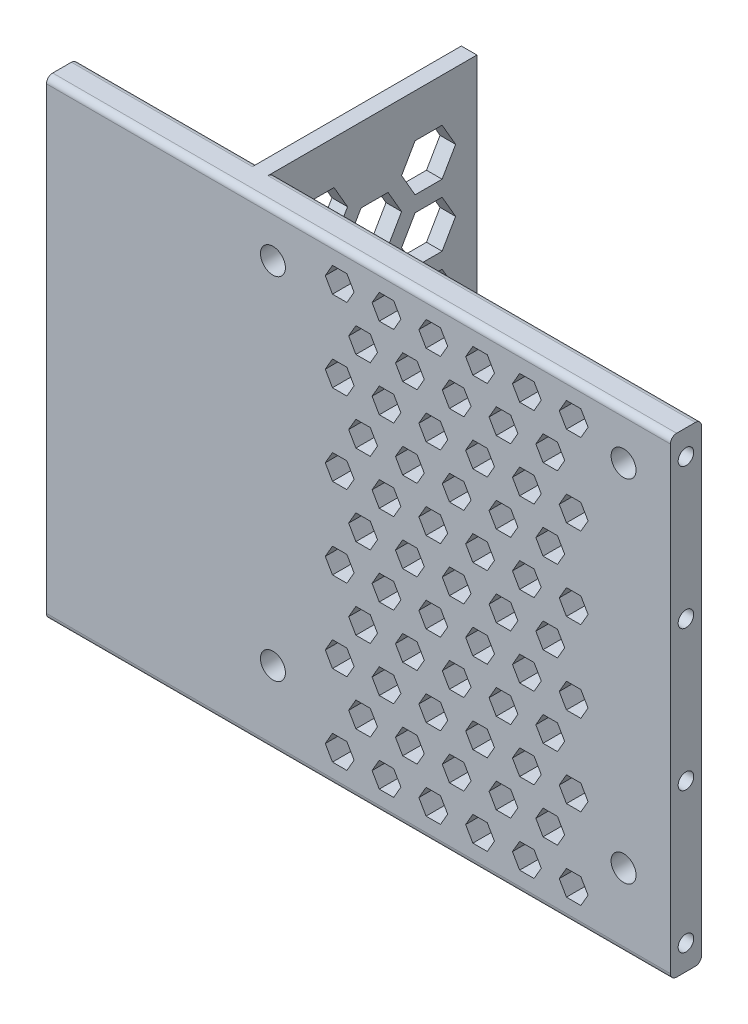
from build123d import *

# Parameters (mm, degrees)
SKETCH_1_W                   = 200
SKETCH_1_H                   = 151
SKETCH_1_R                   = 1.8
EXTRUDE_1_DEPTH              = 10
SKETCH_2_R                   = 2.5
CUT_EXTRUDE_1_DEPTH          = 15
SKETCH_3_R                   = 4
CUT_EXTRUDE_2_DEPTH          = 7
SKETCH_4_W                   = 5
SKETCH_4_H                   = 151
EXTRUDE_2_DEPTH              = 65
CUT_EXTRUDE_3_REACH          = 147.61
SPLIT_START                  = -65
SPLIT_BODIES_1_OUTLINE_W     = 5
SPLIT_BODIES_1_OUTLINE_H     = 151
SPLIT_BODIES_1_DEPTH         = 75
SPLIT_BODIES_1_2_OUTLINE_W   = 18
SPLIT_BODIES_1_2_OUTLINE_H   = 151
SPLIT_BODIES_1_2_OUTLINE_R   = 4
SPLIT_BODIES_1_2_OUTLINE_W_2 = 5
SPLIT_BODIES_1_2_DEPTH       = 10
SPLIT_BODIES_1_3_OUTLINE_R   = 4
SPLIT_BODIES_1_3_OUTLINE_R_2 = 1.8
SPLIT_BODIES_1_3_DEPTH       = 3
SPLIT_BODIES_1_4_OUTLINE_W   = 99
SPLIT_BODIES_1_4_OUTLINE_H   = 151
SPLIT_BODIES_1_4_DEPTH       = 10
SPLIT_START_2                = -102.846480906
SPLIT_BODIES_1_5_OUTLINE_W   = 151
SPLIT_BODIES_1_5_OUTLINE_H   = 10
SPLIT_BODIES_1_5_OUTLINE_R   = 2.5
SPLIT_BODIES_1_5_DEPTH       = 15
SPLIT_BODIES_1_6_OUTLINE_W   = 151
SPLIT_BODIES_1_6_OUTLINE_H   = 75
SPLIT_BODIES_1_6_DEPTH       = 180
SPLIT_START_3                = -87.846480906
SPLIT_BODIES_1_7_OUTLINE_W   = 151
SPLIT_BODIES_1_7_OUTLINE_H   = 10
SPLIT_BODIES_1_7_DEPTH       = 38
OTHER_2_DEPTH                = 10
FILLET_1_R                   = 2
CUT_EXTRUDE_4_REACH          = 177.468
OTHER_START                  = -44.846480906
OTHER_3_DEPTH                = 5


with BuildPart() as part:
    # 草图1 → 凸台-拉伸1 (new body)
    with BuildSketch(Plane.XY):
        with Locations((-2.846480906, -4.5)):
            Rectangle(SKETCH_1_W, SKETCH_1_H)
        with Locations((-30.246480906, 56.2)):
            Circle(SKETCH_1_R, mode=Mode.SUBTRACT)
        with Locations((82.153519094, 56.2)):
            Circle(SKETCH_1_R, mode=Mode.SUBTRACT)
        with Locations((82.153519094, -56.2)):
            Circle(SKETCH_1_R, mode=Mode.SUBTRACT)
        with Locations((-30.246480906, -56.2)):
            Circle(SKETCH_1_R, mode=Mode.SUBTRACT)
    extrude(amount=EXTRUDE_1_DEPTH)

    # 草图2 → 切除-拉伸1 (cut)
    with BuildSketch(Plane.ZY.offset(102.846480906)):
        with Locations((5, 63)):
            Circle(SKETCH_2_R)
        with Locations((5, 18)):
            Circle(SKETCH_2_R)
        with Locations((5, -27)):
            Circle(SKETCH_2_R)
        with Locations((5, -72)):
            Circle(SKETCH_2_R)
    cut_extrude_1 = extrude(amount=-CUT_EXTRUDE_1_DEPTH, mode=Mode.SUBTRACT)

    # 镜向1: 切除-拉伸1 across plane
    add(cut_extrude_1.mirror(Plane.ZY.offset(2.846480906)), mode=Mode.SUBTRACT)

    # 草图3 → 切除-拉伸2 (cut)
    with BuildSketch(Plane.XY.offset(10)):
        with Locations((-30.246480906, 56.2)):
            Circle(SKETCH_3_R)
        with Locations((82.153519094, 56.2)):
            Circle(SKETCH_3_R)
        with Locations((82.153519094, -56.2)):
            Circle(SKETCH_3_R)
        with Locations((-30.246480906, -56.2)):
            Circle(SKETCH_3_R)
    extrude(amount=-CUT_EXTRUDE_2_DEPTH, mode=Mode.SUBTRACT)

    # 草图4 → 凸台-拉伸2 (add)
    with BuildSketch(Plane(origin=(0, 0, 0), x_dir=(-1, 0, 0), z_dir=(0, 0, -1))):
        with Locations((42.346480906, -4.5)):
            Rectangle(SKETCH_4_W, SKETCH_4_H)
    extrude(amount=EXTRUDE_2_DEPTH)

    # 草图5 → 切除-拉伸3 (cut, up to next)
    with BuildSketch(Plane(origin=(0, 0, 0), x_dir=(-1, 0, 0), z_dir=(0, 0, -1)), mode=Mode.PRIVATE) as cut_extrude_3_sk1:
        Polygon((-24.034716941, -4.5), (-26.344118017, -0.5), (-30.962920171, -0.5), (-33.272321248, -4.5), (-30.962920171, -8.5), (-26.344118017, -8.5), align=None)
    cut_extrude_3_tool1 = extrude(cut_extrude_3_sk1.sketch, amount=-CUT_EXTRUDE_3_REACH, mode=Mode.PRIVATE) & part.part
    add(cut_extrude_3_tool1.solids().sort_by_distance((28.653519, -4.5, 0))[0], mode=Mode.SUBTRACT)

    # Split Bodies 1 6 outline → Split Bodies 1 6 (cut)
    with BuildSketch(Plane.YZ.offset(SPLIT_START_2)):
        with Locations((-4.5, -27.5)):
            Rectangle(SPLIT_BODIES_1_6_OUTLINE_W, SPLIT_BODIES_1_6_OUTLINE_H)
    extrude(amount=SPLIT_BODIES_1_6_DEPTH, mode=Mode.SUBTRACT)


with BuildPart() as body_2:
    # Split Bodies 1: read off the stored shape, not the designer's step
    # Split Bodies 1 outline → Split Bodies 1 (new body)
    with BuildSketch(Plane.XY.offset(SPLIT_START)):
        with Locations((-42.346480906, -4.5)):
            Rectangle(SPLIT_BODIES_1_OUTLINE_W, SPLIT_BODIES_1_OUTLINE_H)
    extrude(amount=SPLIT_BODIES_1_DEPTH)

    # Split Bodies 1 2 outline → Split Bodies 1 2 (add)
    # profile 1 of 2: a face of its own
    with BuildSketch(Plane.XY):
        with Locations((-30.846480906, -4.5)):
            Rectangle(SPLIT_BODIES_1_2_OUTLINE_W, SPLIT_BODIES_1_2_OUTLINE_H)
        with Locations((-30.246480906, -56.2)):
            Circle(SPLIT_BODIES_1_2_OUTLINE_R, mode=Mode.SUBTRACT)
        with Locations((-30.246480906, 56.2)):
            Circle(SPLIT_BODIES_1_2_OUTLINE_R, mode=Mode.SUBTRACT)
    # profile 2 of 2: a face of its own
    with BuildSketch(Plane.XY):
        with Locations((-47.346480906, -4.5)):
            Rectangle(SPLIT_BODIES_1_2_OUTLINE_W_2, SPLIT_BODIES_1_2_OUTLINE_H)
    extrude(amount=SPLIT_BODIES_1_2_DEPTH)

    # Split Bodies 1 3 outline → Split Bodies 1 3 (add)
    # profile 1 of 2: a face of its own
    with BuildSketch(Plane.XY):
        with Locations((-30.246480906, 56.2)):
            Circle(SPLIT_BODIES_1_3_OUTLINE_R)
        with Locations((-30.246480906, 56.2)):
            Circle(SPLIT_BODIES_1_3_OUTLINE_R_2, mode=Mode.SUBTRACT)
    # profile 2 of 2: a face of its own
    with BuildSketch(Plane.XY):
        with Locations((-30.246480906, -56.2)):
            Circle(SPLIT_BODIES_1_3_OUTLINE_R)
        with Locations((-30.246480906, -56.2)):
            Circle(SPLIT_BODIES_1_3_OUTLINE_R_2, mode=Mode.SUBTRACT)
    extrude(amount=SPLIT_BODIES_1_3_DEPTH)


with BuildPart() as body_3:
    # Split Bodies 1 4 outline → Split Bodies 1 4 (new body)
    with BuildSketch(Plane.XY):
        with Locations((27.653519094, -4.5)):
            Rectangle(SPLIT_BODIES_1_4_OUTLINE_W, SPLIT_BODIES_1_4_OUTLINE_H)
        Polygon((30.962920171, -8.5), (26.344118017, -8.5), (24.034716941, -4.5), (26.344118017, -0.5), (30.962920171, -0.5), (33.272321248, -4.5), align=None, mode=Mode.SUBTRACT)
    extrude(amount=SPLIT_BODIES_1_4_DEPTH)

    # 填充阵列2: read off the stored shape, not the designer's step
    # 填充阵列2 outline → 填充阵列2 (cut)
    with BuildSketch(Plane.XY):
        Polygon((39.034716941, -4.5), (41.344118017, -8.5), (45.962920171, -8.5), (48.272321248, -4.5), (45.962920171, -0.5), (41.344118017, -0.5), align=None)
        Polygon((54.034716941, -4.5), (56.344118017, -8.5), (60.962920171, -8.5), (63.272321248, -4.5), (60.962920171, -0.5), (56.344118017, -0.5), align=None)
        Polygon((-5.965283059, -4.5), (-3.655881983, -8.5), (0.962920171, -8.5), (3.272321248, -4.5), (0.962920171, -0.5), (-3.655881983, -0.5), align=None)
        Polygon((9.034716941, -4.5), (11.344118017, -8.5), (15.962920171, -8.5), (18.272321248, -4.5), (15.962920171, -0.5), (11.344118017, -0.5), align=None)
        Polygon((56.344118017, 43.461524227), (60.962920171, 43.461524227), (63.272321248, 47.461524227), (60.962920171, 51.461524227), (56.344118017, 51.461524227), (54.034716941, 47.461524227), align=None)
        Polygon((63.844118017, 56.451905284), (68.462920171, 56.451905284), (70.772321248, 60.451905284), (68.462920171, 64.451905284), (63.844118017, 64.451905284), (61.534716941, 60.451905284), align=None)
        Polygon((48.844118017, 30.47114317), (53.462920171, 30.47114317), (55.772321248, 34.47114317), (53.462920171, 38.47114317), (48.844118017, 38.47114317), (46.534716941, 34.47114317), align=None)
        Polygon((41.344118017, 17.480762114), (45.962920171, 17.480762114), (48.272321248, 21.480762114), (45.962920171, 25.480762114), (41.344118017, 25.480762114), (39.034716941, 21.480762114), align=None)
        Polygon((33.844118017, 4.490381057), (38.462920171, 4.490381057), (40.772321248, 8.490381057), (38.462920171, 12.490381057), (33.844118017, 12.490381057), (31.534716941, 8.490381057), align=None)
        Polygon((18.844118017, -21.490381057), (23.462920171, -21.490381057), (25.772321248, -17.490381057), (23.462920171, -13.490381057), (18.844118017, -13.490381057), (16.534716941, -17.490381057), align=None)
        Polygon((11.344118017, -34.480762114), (15.962920171, -34.480762114), (18.272321248, -30.480762114), (15.962920171, -26.480762114), (11.344118017, -26.480762114), (9.034716941, -30.480762114), align=None)
        Polygon((3.844118017, -47.47114317), (8.462920171, -47.47114317), (10.772321248, -43.47114317), (8.462920171, -39.47114317), (3.844118017, -39.47114317), (1.534716941, -43.47114317), align=None)
        Polygon((-3.655881983, -60.461524227), (0.962920171, -60.461524227), (3.272321248, -56.461524227), (0.962920171, -52.461524227), (-3.655881983, -52.461524227), (-5.965283059, -56.461524227), align=None)
        Polygon((-11.155881983, -73.451905284), (-6.537079829, -73.451905284), (-4.227678752, -69.451905284), (-6.537079829, -65.451905284), (-11.155881983, -65.451905284), (-13.465283059, -69.451905284), align=None)
        Polygon((-6.537079829, 56.451905284), (-4.227678752, 60.451905284), (-6.537079829, 64.451905284), (-11.155881983, 64.451905284), (-13.465283059, 60.451905284), (-11.155881983, 56.451905284), align=None)
        Polygon((45.962920171, -34.480762114), (48.272321248, -30.480762114), (45.962920171, -26.480762114), (41.344118017, -26.480762114), (39.034716941, -30.480762114), (41.344118017, -34.480762114), align=None)
        Polygon((38.462920171, -21.490381057), (40.772321248, -17.490381057), (38.462920171, -13.490381057), (33.844118017, -13.490381057), (31.534716941, -17.490381057), (33.844118017, -21.490381057), align=None)
        Polygon((68.462920171, -73.451905284), (70.772321248, -69.451905284), (68.462920171, -65.451905284), (63.844118017, -65.451905284), (61.534716941, -69.451905284), (63.844118017, -73.451905284), align=None)
        Polygon((60.962920171, -60.461524227), (63.272321248, -56.461524227), (60.962920171, -52.461524227), (56.344118017, -52.461524227), (54.034716941, -56.461524227), (56.344118017, -60.461524227), align=None)
        Polygon((53.462920171, -47.47114317), (55.772321248, -43.47114317), (53.462920171, -39.47114317), (48.844118017, -39.47114317), (46.534716941, -43.47114317), (48.844118017, -47.47114317), align=None)
        Polygon((15.962920171, 17.480762114), (18.272321248, 21.480762114), (15.962920171, 25.480762114), (11.344118017, 25.480762114), (9.034716941, 21.480762114), (11.344118017, 17.480762114), align=None)
        Polygon((0.962920171, 43.461524227), (3.272321248, 47.461524227), (0.962920171, 51.461524227), (-3.655881983, 51.461524227), (-5.965283059, 47.461524227), (-3.655881983, 43.461524227), align=None)
        Polygon((8.462920171, 30.47114317), (10.772321248, 34.47114317), (8.462920171, 38.47114317), (3.844118017, 38.47114317), (1.534716941, 34.47114317), (3.844118017, 30.47114317), align=None)
        Polygon((23.462920171, 4.490381057), (25.772321248, 8.490381057), (23.462920171, 12.490381057), (18.844118017, 12.490381057), (16.534716941, 8.490381057), (18.844118017, 4.490381057), align=None)
        Polygon((31.534716941, 60.451905284), (33.844118017, 56.451905284), (38.462920171, 56.451905284), (40.772321248, 60.451905284), (38.462920171, 64.451905284), (33.844118017, 64.451905284), align=None)
        Polygon((1.534716941, 60.451905284), (3.844118017, 56.451905284), (8.462920171, 56.451905284), (10.772321248, 60.451905284), (8.462920171, 64.451905284), (3.844118017, 64.451905284), align=None)
        Polygon((16.534716941, 60.451905284), (18.844118017, 56.451905284), (23.462920171, 56.451905284), (25.772321248, 60.451905284), (23.462920171, 64.451905284), (18.844118017, 64.451905284), align=None)
        Polygon((46.534716941, 60.451905284), (48.844118017, 56.451905284), (53.462920171, 56.451905284), (55.772321248, 60.451905284), (53.462920171, 64.451905284), (48.844118017, 64.451905284), align=None)
        Polygon((18.844118017, -65.451905284), (16.534716941, -69.451905284), (18.844118017, -73.451905284), (23.462920171, -73.451905284), (25.772321248, -69.451905284), (23.462920171, -65.451905284), align=None)
        Polygon((11.344118017, -52.461524227), (9.034716941, -56.461524227), (11.344118017, -60.461524227), (15.962920171, -60.461524227), (18.272321248, -56.461524227), (15.962920171, -52.461524227), align=None)
        Polygon((-11.155881983, -13.490381057), (-13.465283059, -17.490381057), (-11.155881983, -21.490381057), (-6.537079829, -21.490381057), (-4.227678752, -17.490381057), (-6.537079829, -13.490381057), align=None)
        Polygon((-3.655881983, -26.480762114), (-5.965283059, -30.480762114), (-3.655881983, -34.480762114), (0.962920171, -34.480762114), (3.272321248, -30.480762114), (0.962920171, -26.480762114), align=None)
        Polygon((1.534716941, -69.451905284), (3.844118017, -73.451905284), (8.462920171, -73.451905284), (10.772321248, -69.451905284), (8.462920171, -65.451905284), (3.844118017, -65.451905284), align=None)
        Polygon((31.534716941, -69.451905284), (33.844118017, -73.451905284), (38.462920171, -73.451905284), (40.772321248, -69.451905284), (38.462920171, -65.451905284), (33.844118017, -65.451905284), align=None)
        Polygon((46.534716941, -69.451905284), (48.844118017, -73.451905284), (53.462920171, -73.451905284), (55.772321248, -69.451905284), (53.462920171, -65.451905284), (48.844118017, -65.451905284), align=None)
        Polygon((26.344118017, -60.461524227), (30.962920171, -60.461524227), (33.272321248, -56.461524227), (30.962920171, -52.461524227), (26.344118017, -52.461524227), (24.034716941, -56.461524227), align=None)
        Polygon((33.844118017, -47.47114317), (38.462920171, -47.47114317), (40.772321248, -43.47114317), (38.462920171, -39.47114317), (33.844118017, -39.47114317), (31.534716941, -43.47114317), align=None)
        Polygon((48.844118017, -21.490381057), (53.462920171, -21.490381057), (55.772321248, -17.490381057), (53.462920171, -13.490381057), (48.844118017, -13.490381057), (46.534716941, -17.490381057), align=None)
        Polygon((63.844118017, 4.490381057), (68.462920171, 4.490381057), (70.772321248, 8.490381057), (68.462920171, 12.490381057), (63.844118017, 12.490381057), (61.534716941, 8.490381057), align=None)
        Polygon((63.844118017, 38.47114317), (61.534716941, 34.47114317), (63.844118017, 30.47114317), (68.462920171, 30.47114317), (70.772321248, 34.47114317), (68.462920171, 38.47114317), align=None)
        Polygon((16.534716941, 34.47114317), (18.844118017, 30.47114317), (23.462920171, 30.47114317), (25.772321248, 34.47114317), (23.462920171, 38.47114317), (18.844118017, 38.47114317), align=None)
        Polygon((-13.465283059, 34.47114317), (-11.155881983, 30.47114317), (-6.537079829, 30.47114317), (-4.227678752, 34.47114317), (-6.537079829, 38.47114317), (-11.155881983, 38.47114317), align=None)
        Polygon((31.534716941, 34.47114317), (33.844118017, 30.47114317), (38.462920171, 30.47114317), (40.772321248, 34.47114317), (38.462920171, 38.47114317), (33.844118017, 38.47114317), align=None)
        Polygon((56.344118017, 17.480762114), (60.962920171, 17.480762114), (63.272321248, 21.480762114), (60.962920171, 25.480762114), (56.344118017, 25.480762114), (54.034716941, 21.480762114), align=None)
        Polygon((48.844118017, 4.490381057), (53.462920171, 4.490381057), (55.772321248, 8.490381057), (53.462920171, 12.490381057), (48.844118017, 12.490381057), (46.534716941, 8.490381057), align=None)
        Polygon((18.844118017, -47.47114317), (23.462920171, -47.47114317), (25.772321248, -43.47114317), (23.462920171, -39.47114317), (18.844118017, -39.47114317), (16.534716941, -43.47114317), align=None)
        Polygon((26.344118017, -34.480762114), (30.962920171, -34.480762114), (33.272321248, -30.480762114), (30.962920171, -26.480762114), (26.344118017, -26.480762114), (24.034716941, -30.480762114), align=None)
        Polygon((41.344118017, 51.461524227), (39.034716941, 47.461524227), (41.344118017, 43.461524227), (45.962920171, 43.461524227), (48.272321248, 47.461524227), (45.962920171, 51.461524227), align=None)
        Polygon((-5.965283059, 21.480762114), (-3.655881983, 17.480762114), (0.962920171, 17.480762114), (3.272321248, 21.480762114), (0.962920171, 25.480762114), (-3.655881983, 25.480762114), align=None)
        Polygon((24.034716941, 21.480762114), (26.344118017, 17.480762114), (30.962920171, 17.480762114), (33.272321248, 21.480762114), (30.962920171, 25.480762114), (26.344118017, 25.480762114), align=None)
        Polygon((63.844118017, -13.490381057), (61.534716941, -17.490381057), (63.844118017, -21.490381057), (68.462920171, -21.490381057), (70.772321248, -17.490381057), (68.462920171, -13.490381057), align=None)
        Polygon((26.344118017, 51.461524227), (24.034716941, 47.461524227), (26.344118017, 43.461524227), (30.962920171, 43.461524227), (33.272321248, 47.461524227), (30.962920171, 51.461524227), align=None)
        Polygon((1.534716941, 8.490381057), (3.844118017, 4.490381057), (8.462920171, 4.490381057), (10.772321248, 8.490381057), (8.462920171, 12.490381057), (3.844118017, 12.490381057), align=None)
        Polygon((-13.465283059, 8.490381057), (-11.155881983, 4.490381057), (-6.537079829, 4.490381057), (-4.227678752, 8.490381057), (-6.537079829, 12.490381057), (-11.155881983, 12.490381057), align=None)
        Polygon((3.844118017, -13.490381057), (1.534716941, -17.490381057), (3.844118017, -21.490381057), (8.462920171, -21.490381057), (10.772321248, -17.490381057), (8.462920171, -13.490381057), align=None)
        Polygon((39.034716941, -56.461524227), (41.344118017, -60.461524227), (45.962920171, -60.461524227), (48.272321248, -56.461524227), (45.962920171, -52.461524227), (41.344118017, -52.461524227), align=None)
        Polygon((61.534716941, -43.47114317), (63.844118017, -47.47114317), (68.462920171, -47.47114317), (70.772321248, -43.47114317), (68.462920171, -39.47114317), (63.844118017, -39.47114317), align=None)
        Polygon((-13.465283059, -43.47114317), (-11.155881983, -47.47114317), (-6.537079829, -47.47114317), (-4.227678752, -43.47114317), (-6.537079829, -39.47114317), (-11.155881983, -39.47114317), align=None)
        Polygon((54.034716941, -30.480762114), (56.344118017, -34.480762114), (60.962920171, -34.480762114), (63.272321248, -30.480762114), (60.962920171, -26.480762114), (56.344118017, -26.480762114), align=None)
        Polygon((11.344118017, 51.461524227), (9.034716941, 47.461524227), (11.344118017, 43.461524227), (15.962920171, 43.461524227), (18.272321248, 47.461524227), (15.962920171, 51.461524227), align=None)
    extrude(amount=OTHER_2_DEPTH, mode=Mode.SUBTRACT)


with BuildPart() as body_4:
    # Split Bodies 1 5 outline → Split Bodies 1 5 (new body)
    with BuildSketch(Plane.YZ.offset(SPLIT_START_2)):
        with Locations((-4.5, 5)):
            Rectangle(SPLIT_BODIES_1_5_OUTLINE_W, SPLIT_BODIES_1_5_OUTLINE_H)
        with Locations((-72, 5)):
            Circle(SPLIT_BODIES_1_5_OUTLINE_R, mode=Mode.SUBTRACT)
        with Locations((-27, 5)):
            Circle(SPLIT_BODIES_1_5_OUTLINE_R, mode=Mode.SUBTRACT)
        with Locations((18, 5)):
            Circle(SPLIT_BODIES_1_5_OUTLINE_R, mode=Mode.SUBTRACT)
        with Locations((63, 5)):
            Circle(SPLIT_BODIES_1_5_OUTLINE_R, mode=Mode.SUBTRACT)
    extrude(amount=SPLIT_BODIES_1_5_DEPTH)


with BuildPart() as body_5:
    # Split Bodies 1 7 outline → Split Bodies 1 7 (new body)
    with BuildSketch(Plane.YZ.offset(SPLIT_START_3)):
        with Locations((-4.5, 5)):
            Rectangle(SPLIT_BODIES_1_7_OUTLINE_W, SPLIT_BODIES_1_7_OUTLINE_H)
    extrude(amount=SPLIT_BODIES_1_7_DEPTH)


with BuildPart() as body_3_1:
    add(body_3.part)

    # Combine 1: read off the stored shape, not the designer's step
    # Combine 1: union body 2, body 4, part, body 5
    add(body_2.part)
    add(body_4.part)
    add(part.part)
    add(body_5.part)

    # 圆角1
    fillet_1_edges = [body_3_1.edges().sort_by_distance(p)[0] for p in [
        (-2.846480906, -80, 10),
        (-2.846480906, 71, 10),
        (-73.846480906, 71, 0),
        (-73.846480906, -80, 0),
        (28.653519094, 71, 0),
        (28.653519094, -80, 0),
    ]]
    fillet(fillet_1_edges, radius=FILLET_1_R)

    # 草图7 → 切除-拉伸4 (cut, up to next)
    with BuildSketch(Plane.ZY.offset(44.846480906), mode=Mode.PRIVATE) as cut_extrude_4_sk1:
        Polygon((-23.520506898, -0.393037509), (-27.850633917, 7.106962491), (-36.510887955, 7.106962491), (-40.841014973, -0.393037509), (-36.510887955, -7.893037509), (-27.850633917, -7.893037509), align=None)
    cut_extrude_4_tool1 = extrude(cut_extrude_4_sk1.sketch, amount=-CUT_EXTRUDE_4_REACH, mode=Mode.PRIVATE) & body_3_1.part
    add(cut_extrude_4_tool1.solids().sort_by_distance((-44.846481, -0.393038, -32.180761))[0], mode=Mode.SUBTRACT)

    # 填充阵列3: read off the stored shape, not the designer's step
    # 填充阵列3 outline → 填充阵列3 (cut)
    with BuildSketch(Plane.YZ.offset(OTHER_START)):
        Polygon((-22.893037509, -45.171141992), (-30.393037509, -40.841014973), (-37.893037509, -45.171141992), (-37.893037509, -53.83139603), (-30.393037509, -58.161523049), (-22.893037509, -53.83139603), align=None)
        Polygon((37.106962491, -10.530125841), (29.606962491, -6.199998822), (22.106962491, -10.530125841), (22.106962491, -19.190379879), (29.606962491, -23.520506898), (37.106962491, -19.190379879), align=None)
        Polygon((-37.893037509, -10.530125841), (-37.893037509, -19.190379879), (-30.393037509, -23.520506898), (-22.893037509, -19.190379879), (-22.893037509, -10.530125841), (-30.393037509, -6.199998822), align=None)
        Polygon((22.106962491, -45.171141992), (22.106962491, -53.83139603), (29.606962491, -58.161523049), (37.106962491, -53.83139603), (37.106962491, -45.171141992), (29.606962491, -40.841014973), align=None)
        Polygon((-52.893037509, -27.850633917), (-60.393037509, -23.520506898), (-67.893037509, -27.850633917), (-67.893037509, -36.510887955), (-60.393037509, -40.841014973), (-52.893037509, -36.510887955), align=None)
        Polygon((-12.893037509, -27.850633917), (-20.393037509, -23.520506898), (-27.893037509, -27.850633917), (-27.893037509, -36.510887955), (-20.393037509, -40.841014973), (-12.893037509, -36.510887955), align=None)
        Polygon((-42.893037509, -45.171141992), (-50.393037509, -40.841014973), (-57.893037509, -45.171141992), (-57.893037509, -53.83139603), (-50.393037509, -58.161523049), (-42.893037509, -53.83139603), align=None)
        Polygon((17.106962491, -10.530125841), (9.606962491, -6.199998822), (2.106962491, -10.530125841), (2.106962491, -19.190379879), (9.606962491, -23.520506898), (17.106962491, -19.190379879), align=None)
        Polygon((-57.893037509, -10.530125841), (-57.893037509, -19.190379879), (-50.393037509, -23.520506898), (-42.893037509, -19.190379879), (-42.893037509, -10.530125841), (-50.393037509, -6.199998822), align=None)
        Polygon((2.106962491, -45.171141992), (2.106962491, -53.83139603), (9.606962491, -58.161523049), (17.106962491, -53.83139603), (17.106962491, -45.171141992), (9.606962491, -40.841014973), align=None)
        Polygon((-2.893037509, -45.171141992), (-10.393037509, -40.841014973), (-17.893037509, -45.171141992), (-17.893037509, -53.83139603), (-10.393037509, -58.161523049), (-2.893037509, -53.83139603), align=None)
        Polygon((57.106962491, -10.530125841), (49.606962491, -6.199998822), (42.106962491, -10.530125841), (42.106962491, -19.190379879), (49.606962491, -23.520506898), (57.106962491, -19.190379879), align=None)
        Polygon((27.106962491, -27.850633917), (19.606962491, -23.520506898), (12.106962491, -27.850633917), (12.106962491, -36.510887955), (19.606962491, -40.841014973), (27.106962491, -36.510887955), align=None)
        Polygon((-10.393037509, -6.199998822), (-17.893037509, -10.530125841), (-17.893037509, -19.190379879), (-10.393037509, -23.520506898), (-2.893037509, -19.190379879), (-2.893037509, -10.530125841), align=None)
        Polygon((-47.893037509, -27.850633917), (-47.893037509, -36.510887955), (-40.393037509, -40.841014973), (-32.893037509, -36.510887955), (-32.893037509, -27.850633917), (-40.393037509, -23.520506898), align=None)
        Polygon((42.106962491, -45.171141992), (42.106962491, -53.83139603), (49.606962491, -58.161523049), (57.106962491, -53.83139603), (57.106962491, -45.171141992), (49.606962491, -40.841014973), align=None)
        Polygon((47.106962491, -27.850633917), (39.606962491, -23.520506898), (32.106962491, -27.850633917), (32.106962491, -36.510887955), (39.606962491, -40.841014973), (47.106962491, -36.510887955), align=None)
    extrude(amount=OTHER_3_DEPTH, mode=Mode.SUBTRACT)


solid = body_3_1.part
